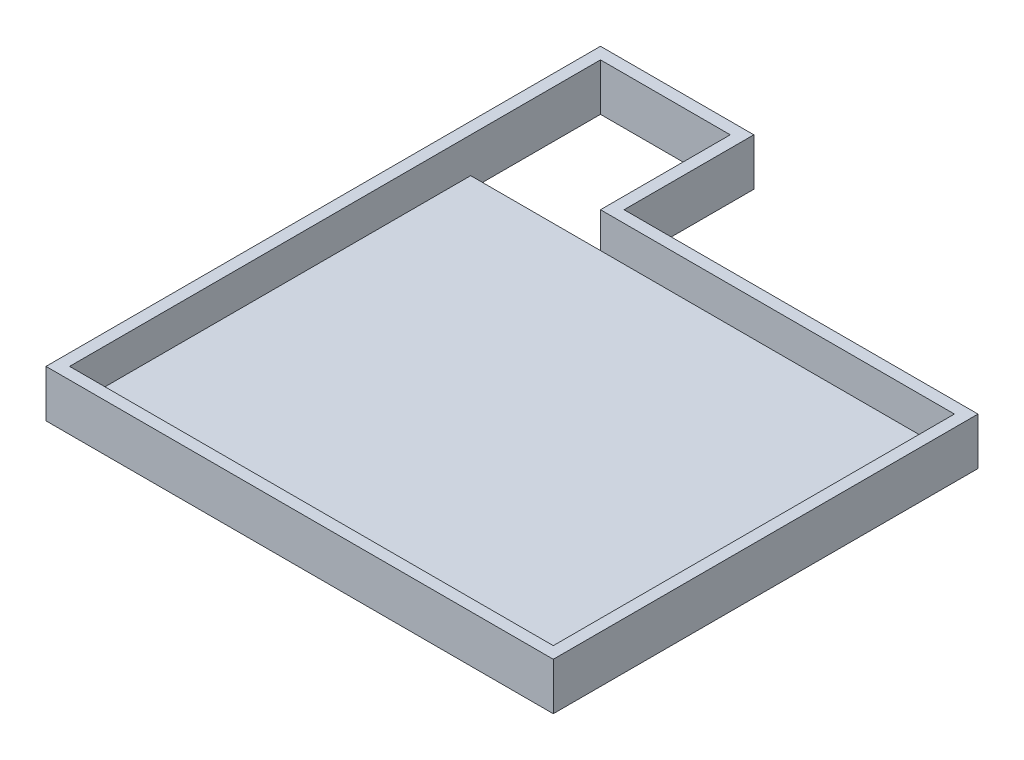
from build123d import *

# Parameters (mm, degrees)
EXTRUDE_1_OUTLINE_W = 215
EXTRUDE_1_OUTLINE_H = 235
EXTRUDE_1_DEPTH     = 5
SKETCH_3_W          = 150
SKETCH_3_H          = 55
CUT_EXTRUDE_1_DEPTH = 1813.363972104
EXTRUDE_1_2_DEPTH   = 15
SKETCH_5_W          = 55
SKETCH_5_H          = 55
CUT_EXTRUDE_2_DEPTH = 1813.419147819


# Read off the part's stored shape, not the designer's step: 凸台-拉伸1
with BuildPart() as part:
    # Extrude 1 outline → Extrude 1 (new body)
    with BuildSketch(Plane(origin=(0, 0, 0), x_dir=(1, 0, 0), z_dir=(0, 1, 0))):
        with Locations((-564.05165919, -1565.846825945)):
            Rectangle(EXTRUDE_1_OUTLINE_W, EXTRUDE_1_OUTLINE_H)
    extrude(amount=EXTRUDE_1_DEPTH)

    # 草图3 → 切除-拉伸1 (cut, through all)
    with BuildSketch(Plane(origin=(0, 5, 0), x_dir=(1, 0, 0), z_dir=(0, 1, 0))):
        with Locations((-531.55165919, -1475.846825945)):
            Rectangle(SKETCH_3_W, SKETCH_3_H)
    extrude(amount=-CUT_EXTRUDE_1_DEPTH, mode=Mode.SUBTRACT)

    # 草图4 → Extrude 1 2 (add)
    with BuildSketch(Plane(origin=(0, 5, 0), x_dir=(1, 0, 0), z_dir=(0, 1, 0))):
        Polygon((-456.55165919, -1503.346825945), (-606.55165919, -1503.346825945), (-606.55165919, -1448.346825945), (-671.55165919, -1448.346825945), (-671.55165919, -1683.346825945), (-456.55165919, -1683.346825945), align=None)
        Polygon((-461.55165919, -1508.346825945), (-611.55165919, -1508.346825945), (-611.55165919, -1453.346825945), (-666.55165919, -1453.346825945), (-666.55165919, -1678.346825945), (-461.55165919, -1678.346825945), align=None, mode=Mode.SUBTRACT)
    extrude(amount=EXTRUDE_1_2_DEPTH)

    # 草图5 → 切除-拉伸2 (cut, through all)
    with BuildSketch(Plane(origin=(0, 5, 0), x_dir=(1, 0, 0), z_dir=(0, 1, 0))):
        with Locations((-639.05165919, -1480.846825945)):
            Rectangle(SKETCH_5_W, SKETCH_5_H)
    extrude(amount=-CUT_EXTRUDE_2_DEPTH, mode=Mode.SUBTRACT)


solid = part.part
